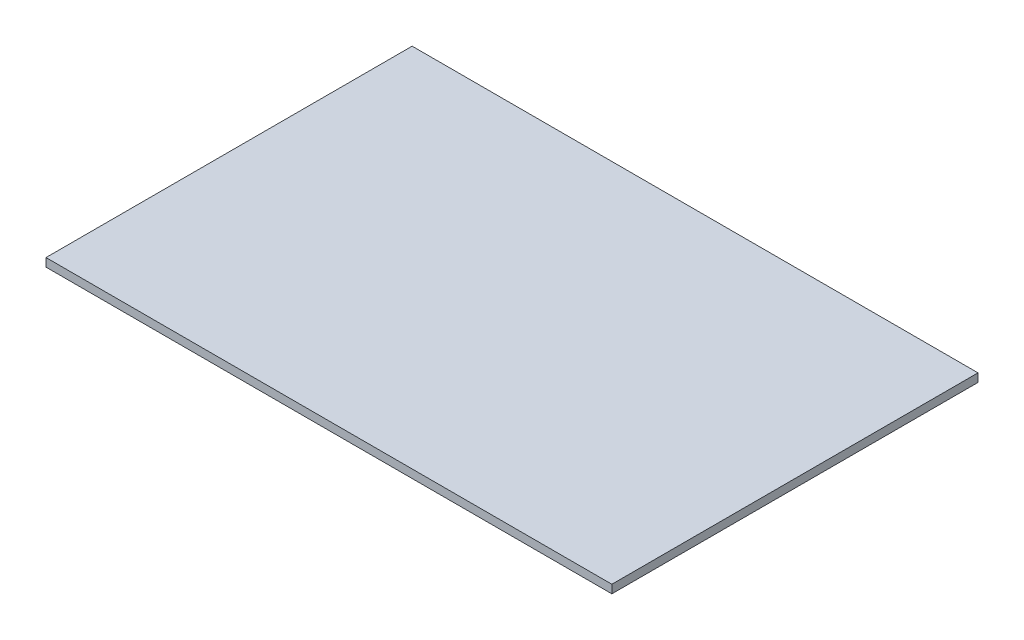
from build123d import *

# Parameters (mm, degrees)
SKETCH1_W           = 340
SKETCH1_H           = 220
BOSS_EXTRUDE1_DEPTH = 5


with BuildPart() as part:
    # Sketch1 → Boss-Extrude1 (new body)
    with BuildSketch(Plane(origin=(0, 0, 0), x_dir=(1, 0, 0), z_dir=(0, 1, 0))):
        Rectangle(SKETCH1_W, SKETCH1_H)
    extrude(amount=BOSS_EXTRUDE1_DEPTH)


solid = part.part
